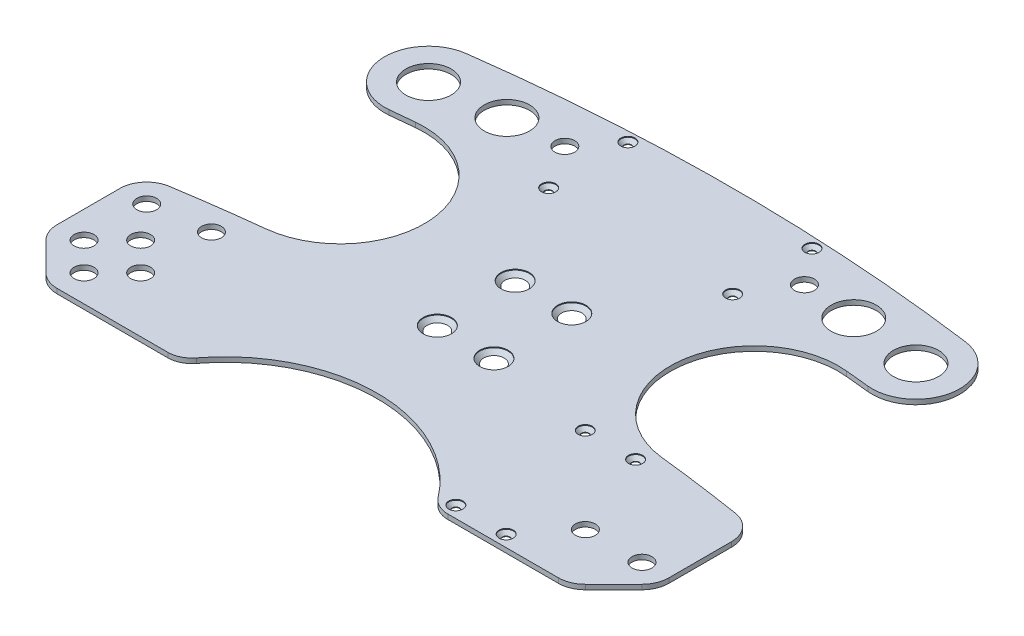
from build123d import *

# Parameters (mm, degrees)
SKETCH1_R                                      = 2.5
BOSS_EXTRUDE1_DEPTH                            = 1.7
CUT_EXTRUDE1_REACH                             = 155.062
SKETCH2_R                                      = 3.5
SKETCH2_R_2                                    = 8
CUT_EXTRUDE2_REACH                             = 155.062
SKETCH3_R                                      = 1.3
CSK_FOR_M5_FLAT_HEAD_MACHINE_SCREW1_AT_2_COUNT = 2
CSK_FOR_M5_FLAT_HEAD_MACHINE_SCREW1_AT_2_PITCH = 20
CSK_FOR_M5_FLAT_HEAD_MACHINE_SCREW1_AT_3_COUNT = 2
CSK_FOR_M5_FLAT_HEAD_MACHINE_SCREW1_AT_3_PITCH = 34.003676272
CSK_FOR_M5_FLAT_HEAD_MACHINE_SCREW1_AT_4_COUNT = 2
CSK_FOR_M5_FLAT_HEAD_MACHINE_SCREW1_AT_4_PITCH = 27.5
CUT_EXTRUDE3_REACH                             = 136.744
SKETCH8_R                                      = 1.3
CSK_FOR_M2_5_FLAT_HEAD_MACHINE_SCREW1_AT_COUNT = 2
CSK_FOR_M2_5_FLAT_HEAD_MACHINE_SCREW1_AT_PITCH = 17.78
CSK_FOR_M2_5_FLAT_HEAD_MACHINE_SCREW_2_COUNT   = 2
CSK_FOR_M2_5_FLAT_HEAD_MACHINE_SCREW_2_PITCH   = 49.055548106
CSK_FOR_M2_5_FLAT_HEAD_MACHINE_SCREW_3_COUNT   = 2
CSK_FOR_M2_5_FLAT_HEAD_MACHINE_SCREW_3_PITCH   = 45.72
CSK_FOR_M2_5_FLAT_HEAD_MACHINE_SCREW_4_COUNT   = 2
CSK_FOR_M2_5_FLAT_HEAD_MACHINE_SCREW_4_PITCH   = 96.995284539
CSK_FOR_M2_5_FLAT_HEAD_MACHINE_SCREW_5_COUNT   = 2
CSK_FOR_M2_5_FLAT_HEAD_MACHINE_SCREW_5_PITCH   = 69.509163048
CSK_FOR_M2_5_FLAT_HEAD_MACHINE_SCREW_6_COUNT   = 2
CSK_FOR_M2_5_FLAT_HEAD_MACHINE_SCREW_6_PITCH   = 125.17053696
CSK_FOR_M2_5_FLAT_HEAD_MACHINE_SCREW_7_COUNT   = 2
CSK_FOR_M2_5_FLAT_HEAD_MACHINE_SCREW_7_PITCH   = 105.3143003
FILLET1_R                                      = 8.5


with BuildPart() as part:
    # Sketch1 → Boss-Extrude1 (new body)
    with BuildSketch(Plane(origin=(0, 0, 0), x_dir=(1, 0, 0), z_dir=(0, 1, 0))):
        with BuildLine():
            Line((-73.314391493, -95), (73.314391493, -95))
            ThreePointArc((73.314391493, -95), (120, 0), (73.314391493, 95))
            Line((73.314391493, 95), (-73.314391493, 95))
            ThreePointArc((-73.314391493, 95), (-120, 0), (-73.314391493, -95))
        make_face()
        with Locations((-10, 13.75)):
            Circle(SKETCH1_R, mode=Mode.SUBTRACT)
        with Locations((-10, -13.75)):
            Circle(SKETCH1_R, mode=Mode.SUBTRACT)
        with Locations((10, -13.75)):
            Circle(SKETCH1_R, mode=Mode.SUBTRACT)
        with Locations((10, 13.75)):
            Circle(SKETCH1_R, mode=Mode.SUBTRACT)
    extrude(amount=BOSS_EXTRUDE1_DEPTH)

    # Sketch2 → Cut-Extrude1 (cut, up to next)
    with BuildSketch(Plane(origin=(0, 1.7, 0), x_dir=(1, 0, 0), z_dir=(0, 1, 0)), mode=Mode.PRIVATE) as cut_extrude1_sk1:
        with Locations((-88.540600769, -40)):
            Circle(SKETCH2_R)
    cut_extrude1_tool1 = extrude(cut_extrude1_sk1.sketch, amount=-CUT_EXTRUDE1_REACH, mode=Mode.PRIVATE) & part.part
    # Sketch2 → Cut-Extrude1 (cut, up to next)
    with BuildSketch(Plane(origin=(0, 1.7, 0), x_dir=(1, 0, 0), z_dir=(0, 1, 0)), mode=Mode.PRIVATE) as cut_extrude1_sk2:
        with Locations((-78.540600769, -50)):
            Circle(SKETCH2_R)
    cut_extrude1_tool2 = extrude(cut_extrude1_sk2.sketch, amount=-CUT_EXTRUDE1_REACH, mode=Mode.PRIVATE) & part.part
    # Sketch2 → Cut-Extrude1 (cut, up to next)
    with BuildSketch(Plane(origin=(0, 1.7, 0), x_dir=(1, 0, 0), z_dir=(0, 1, 0)), mode=Mode.PRIVATE) as cut_extrude1_sk3:
        with Locations((-88.540600769, -60)):
            Circle(SKETCH2_R)
    cut_extrude1_tool3 = extrude(cut_extrude1_sk3.sketch, amount=-CUT_EXTRUDE1_REACH, mode=Mode.PRIVATE) & part.part
    # Sketch2 → Cut-Extrude1 (cut, up to next)
    with BuildSketch(Plane(origin=(0, 1.7, 0), x_dir=(1, 0, 0), z_dir=(0, 1, 0)), mode=Mode.PRIVATE) as cut_extrude1_sk4:
        with Locations((-98.540600769, -50)):
            Circle(SKETCH2_R)
    cut_extrude1_tool4 = extrude(cut_extrude1_sk4.sketch, amount=-CUT_EXTRUDE1_REACH, mode=Mode.PRIVATE) & part.part
    # Sketch2 → Cut-Extrude1 (cut, up to next)
    with BuildSketch(Plane(origin=(0, 1.7, 0), x_dir=(1, 0, 0), z_dir=(0, 1, 0)), mode=Mode.PRIVATE) as cut_extrude1_sk5:
        with Locations((78.540600769, -50)):
            Circle(SKETCH2_R)
    cut_extrude1_tool5 = extrude(cut_extrude1_sk5.sketch, amount=-CUT_EXTRUDE1_REACH, mode=Mode.PRIVATE) & part.part
    # Sketch2 → Cut-Extrude1 (cut, up to next)
    with BuildSketch(Plane(origin=(0, 1.7, 0), x_dir=(1, 0, 0), z_dir=(0, 1, 0)), mode=Mode.PRIVATE) as cut_extrude1_sk6:
        with Locations((98.540600769, -50)):
            Circle(SKETCH2_R)
    cut_extrude1_tool6 = extrude(cut_extrude1_sk6.sketch, amount=-CUT_EXTRUDE1_REACH, mode=Mode.PRIVATE) & part.part
    # Sketch2 → Cut-Extrude1 (cut, up to next)
    with BuildSketch(Plane(origin=(0, 1.7, 0), x_dir=(1, 0, 0), z_dir=(0, 1, 0)), mode=Mode.PRIVATE) as cut_extrude1_sk7:
        with Locations((-98.540600769, -27.862546721)):
            Circle(SKETCH2_R)
    cut_extrude1_tool7 = extrude(cut_extrude1_sk7.sketch, amount=-CUT_EXTRUDE1_REACH, mode=Mode.PRIVATE) & part.part
    # Sketch2 → Cut-Extrude1 (cut, up to next)
    with BuildSketch(Plane(origin=(0, 1.7, 0), x_dir=(1, 0, 0), z_dir=(0, 1, 0)), mode=Mode.PRIVATE) as cut_extrude1_sk8:
        with Locations((-78.540600769, -25)):
            Circle(SKETCH2_R)
    cut_extrude1_tool8 = extrude(cut_extrude1_sk8.sketch, amount=-CUT_EXTRUDE1_REACH, mode=Mode.PRIVATE) & part.part
    # Sketch2 → Cut-Extrude1 (cut, up to next)
    with BuildSketch(Plane(origin=(0, 1.7, 0), x_dir=(1, 0, 0), z_dir=(0, 1, 0)), mode=Mode.PRIVATE) as cut_extrude1_sk9:
        with Locations((-86.094520408, 59.228232759)):
            Circle(SKETCH2_R_2)
    cut_extrude1_tool9 = extrude(cut_extrude1_sk9.sketch, amount=-CUT_EXTRUDE1_REACH, mode=Mode.PRIVATE) & part.part
    # Sketch2 → Cut-Extrude1 (cut, up to next)
    with BuildSketch(Plane(origin=(0, 1.7, 0), x_dir=(1, 0, 0), z_dir=(0, 1, 0)), mode=Mode.PRIVATE) as cut_extrude1_sk10:
        with Locations((-61.259580586, 62.084312054)):
            Circle(SKETCH2_R_2)
    cut_extrude1_tool10 = extrude(cut_extrude1_sk10.sketch, amount=-CUT_EXTRUDE1_REACH, mode=Mode.PRIVATE) & part.part
    # Sketch2 → Cut-Extrude1 (cut, up to next)
    with BuildSketch(Plane(origin=(0, 1.7, 0), x_dir=(1, 0, 0), z_dir=(0, 1, 0)), mode=Mode.PRIVATE) as cut_extrude1_sk11:
        with Locations((61.259580586, 62.084312054)):
            Circle(SKETCH2_R_2)
    cut_extrude1_tool11 = extrude(cut_extrude1_sk11.sketch, amount=-CUT_EXTRUDE1_REACH, mode=Mode.PRIVATE) & part.part
    # Sketch2 → Cut-Extrude1 (cut, up to next)
    with BuildSketch(Plane(origin=(0, 1.7, 0), x_dir=(1, 0, 0), z_dir=(0, 1, 0)), mode=Mode.PRIVATE) as cut_extrude1_sk12:
        with Locations((86.094520408, 59.228232759)):
            Circle(SKETCH2_R_2)
    cut_extrude1_tool12 = extrude(cut_extrude1_sk12.sketch, amount=-CUT_EXTRUDE1_REACH, mode=Mode.PRIVATE) & part.part
    # Sketch2 → Cut-Extrude1 (cut, up to next)
    with BuildSketch(Plane(origin=(0, 1.7, 0), x_dir=(1, 0, 0), z_dir=(0, 1, 0)), mode=Mode.PRIVATE) as cut_extrude1_sk13:
        with Locations((-42.320942156, 63.610082158)):
            Circle(SKETCH2_R)
    cut_extrude1_tool13 = extrude(cut_extrude1_sk13.sketch, amount=-CUT_EXTRUDE1_REACH, mode=Mode.PRIVATE) & part.part
    # Sketch2 → Cut-Extrude1 (cut, up to next)
    with BuildSketch(Plane(origin=(0, 1.7, 0), x_dir=(1, 0, 0), z_dir=(0, 1, 0)), mode=Mode.PRIVATE) as cut_extrude1_sk14:
        with Locations((42.320942156, 63.610082158)):
            Circle(SKETCH2_R)
    cut_extrude1_tool14 = extrude(cut_extrude1_sk14.sketch, amount=-CUT_EXTRUDE1_REACH, mode=Mode.PRIVATE) & part.part
    add(cut_extrude1_tool1.solids().sort_by_distance((-88.540601, 1.7, 40))[0], mode=Mode.SUBTRACT)
    add(cut_extrude1_tool2.solids().sort_by_distance((-78.540601, 1.7, 50))[0], mode=Mode.SUBTRACT)
    add(cut_extrude1_tool3.solids().sort_by_distance((-88.540601, 1.7, 60))[0], mode=Mode.SUBTRACT)
    add(cut_extrude1_tool4.solids().sort_by_distance((-98.540601, 1.7, 50))[0], mode=Mode.SUBTRACT)
    add(cut_extrude1_tool5.solids().sort_by_distance((78.540601, 1.7, 50))[0], mode=Mode.SUBTRACT)
    add(cut_extrude1_tool6.solids().sort_by_distance((98.540601, 1.7, 50))[0], mode=Mode.SUBTRACT)
    add(cut_extrude1_tool7.solids().sort_by_distance((-98.540601, 1.7, 27.862547))[0], mode=Mode.SUBTRACT)
    add(cut_extrude1_tool8.solids().sort_by_distance((-78.540601, 1.7, 25))[0], mode=Mode.SUBTRACT)
    add(cut_extrude1_tool9.solids().sort_by_distance((-86.09452, 1.7, -59.228233))[0], mode=Mode.SUBTRACT)
    add(cut_extrude1_tool10.solids().sort_by_distance((-61.259581, 1.7, -62.084312))[0], mode=Mode.SUBTRACT)
    add(cut_extrude1_tool11.solids().sort_by_distance((61.259581, 1.7, -62.084312))[0], mode=Mode.SUBTRACT)
    add(cut_extrude1_tool12.solids().sort_by_distance((86.09452, 1.7, -59.228233))[0], mode=Mode.SUBTRACT)
    add(cut_extrude1_tool13.solids().sort_by_distance((-42.320942, 1.7, -63.610082))[0], mode=Mode.SUBTRACT)
    add(cut_extrude1_tool14.solids().sort_by_distance((42.320942, 1.7, -63.610082))[0], mode=Mode.SUBTRACT)

    # Sketch3 → Cut-Extrude2 (cut, up to next)
    with BuildSketch(Plane(origin=(0, 1.7, 0), x_dir=(1, 0, 0), z_dir=(0, 1, 0)), mode=Mode.PRIVATE) as cut_extrude2_sk1:
        with BuildLine():
            Line((-76.105925997, 44.650651574), (-84.550645906, 43.805313077))
            ThreePointArc((-84.550645906, 43.805313077), (-99.436668511, 51.3391844), (-98.864520746, 68.013282068))
            ThreePointArc((-98.864520746, 68.013282068), (-119.734623685, 7.97620781), (-107.012417284, -54.298642221))
            ThreePointArc((-107.012417284, -54.298642221), (-107.779979993, -52.209948315), (-108.040600769, -50))
            Line((-108.040600769, -50), (-108.040600769, -27.862546721))
            ThreePointArc((-108.040600769, -27.862546721), (-105.768300058, -21.697292226), (-100.038419088, -18.48136661))
            ThreePointArc((-100.038419088, -18.48136661), (-84.982869082, -16.262381048), (-69.878431955, -14.405108328))
            ThreePointArc((-69.878431955, -14.405108328), (-43.620166463, 18.220082253), (-76.105925997, 44.650651574))
        make_face()
    cut_extrude2_tool1 = extrude(cut_extrude2_sk1.sketch, amount=-CUT_EXTRUDE2_REACH, mode=Mode.PRIVATE) & part.part
    # Sketch3 → Cut-Extrude2 (cut, up to next)
    with BuildSketch(Plane(origin=(0, 1.7, 0), x_dir=(1, 0, 0), z_dir=(0, 1, 0)), mode=Mode.PRIVATE) as cut_extrude2_sk2:
        with BuildLine():
            ThreePointArc((-98.864520746, 68.013282068), (-94.209950954, 72.433905292), (-88.163447862, 74.589532807))
            ThreePointArc((-88.163447862, 74.589532807), (1.3e-08, 80.5), (88.163447888, 74.589532804))
            ThreePointArc((88.163447888, 74.589532804), (94.209951277, 72.433905093), (98.864521161, 68.013281465))
            ThreePointArc((98.864521161, 68.013281465), (87.140491363, 82.50172583), (73.314391493, 95))
            Line((73.314391493, 95), (-73.314391493, 95))
            ThreePointArc((-73.314391493, 95), (-87.140491112, 82.501726096), (-98.864520746, 68.013282068))
        make_face()
    cut_extrude2_tool2 = extrude(cut_extrude2_sk2.sketch, amount=-CUT_EXTRUDE2_REACH, mode=Mode.PRIVATE) & part.part
    # Sketch3 → Cut-Extrude2 (cut, up to next)
    with BuildSketch(Plane(origin=(0, 1.7, 0), x_dir=(1, 0, 0), z_dir=(0, 1, 0)), mode=Mode.PRIVATE) as cut_extrude2_sk3:
        with BuildLine():
            ThreePointArc((-105.258115191, -56.717514421), (-106.230963521, -55.577483371), (-107.012417284, -54.298642221))
            ThreePointArc((-107.012417284, -54.298642221), (-92.431540192, -76.527187181), (-73.314391493, -95))
            Line((-73.314391493, -95), (73.314391493, -95))
            ThreePointArc((73.314391493, -95), (92.431540082, -76.527187314), (107.012417128, -54.298642528))
            ThreePointArc((107.012417128, -54.298642528), (106.23096342, -55.57748351), (105.258115191, -56.717514421))
            Line((105.258115191, -56.717514421), (95.258115191, -66.717514421))
            ThreePointArc((95.258115191, -66.717514421), (92.176093377, -68.776855559), (88.540600769, -69.5))
            Line((88.540600769, -69.5), (45.040600769, -69.5))
            ThreePointArc((45.040600769, -69.5), (0, -45), (-45.040600769, -69.5))
            Line((-45.040600769, -69.5), (-88.540600769, -69.5))
            ThreePointArc((-88.540600769, -69.5), (-92.176093377, -68.776855559), (-95.258115191, -66.717514421))
            Line((-95.258115191, -66.717514421), (-105.258115191, -56.717514421))
        make_face()
    cut_extrude2_tool3 = extrude(cut_extrude2_sk3.sketch, amount=-CUT_EXTRUDE2_REACH, mode=Mode.PRIVATE) & part.part
    # Sketch3 → Cut-Extrude2 (cut, up to next)
    with BuildSketch(Plane(origin=(0, 1.7, 0), x_dir=(1, 0, 0), z_dir=(0, 1, 0)), mode=Mode.PRIVATE) as cut_extrude2_sk4:
        with BuildLine():
            ThreePointArc((69.878431166, -14.405108241), (84.982868127, -16.262380919), (100.038417968, -18.481366431))
            ThreePointArc((100.038417968, -18.481366431), (105.768299691, -21.697291795), (108.040600769, -27.862546721))
            Line((108.040600769, -27.862546721), (108.040600769, -50))
            ThreePointArc((108.040600769, -50), (107.779979953, -52.209948483), (107.012417128, -54.298642528))
            ThreePointArc((107.012417128, -54.298642528), (119.734623721, 7.976207273), (98.864521161, 68.013281465))
            ThreePointArc((98.864521161, 68.013281465), (99.436668324, 51.339184085), (84.550645906, 43.805313077))
            Line((84.550645906, 43.805313077), (76.105925997, 44.650651574))
            ThreePointArc((76.105925997, 44.650651574), (43.620166505, 18.220082647), (69.878431166, -14.405108241))
        make_face()
    cut_extrude2_tool4 = extrude(cut_extrude2_sk4.sketch, amount=-CUT_EXTRUDE2_REACH, mode=Mode.PRIVATE) & part.part
    # Sketch3 → Cut-Extrude2 (cut, up to next)
    with BuildSketch(Plane(origin=(0, 1.7, 0), x_dir=(1, 0, 0), z_dir=(0, 1, 0)), mode=Mode.PRIVATE) as cut_extrude2_sk5:
        with Locations((48.150600769, -19.64)):
            Circle(SKETCH3_R)
    cut_extrude2_tool5 = extrude(cut_extrude2_sk5.sketch, amount=-CUT_EXTRUDE2_REACH, mode=Mode.PRIVATE) & part.part
    # Sketch3 → Cut-Extrude2 (cut, up to next)
    with BuildSketch(Plane(origin=(0, 1.7, 0), x_dir=(1, 0, 0), z_dir=(0, 1, 0)), mode=Mode.PRIVATE) as cut_extrude2_sk6:
        with Locations((65.930600769, -19.64)):
            Circle(SKETCH3_R)
    cut_extrude2_tool6 = extrude(cut_extrude2_sk6.sketch, amount=-CUT_EXTRUDE2_REACH, mode=Mode.PRIVATE) & part.part
    # Sketch3 → Cut-Extrude2 (cut, up to next)
    with BuildSketch(Plane(origin=(0, 1.7, 0), x_dir=(1, 0, 0), z_dir=(0, 1, 0)), mode=Mode.PRIVATE) as cut_extrude2_sk7:
        with Locations((65.930600769, -65.36)):
            Circle(SKETCH3_R)
    cut_extrude2_tool7 = extrude(cut_extrude2_sk7.sketch, amount=-CUT_EXTRUDE2_REACH, mode=Mode.PRIVATE) & part.part
    # Sketch3 → Cut-Extrude2 (cut, up to next)
    with BuildSketch(Plane(origin=(0, 1.7, 0), x_dir=(1, 0, 0), z_dir=(0, 1, 0)), mode=Mode.PRIVATE) as cut_extrude2_sk8:
        with Locations((48.150600769, -65.36)):
            Circle(SKETCH3_R)
    cut_extrude2_tool8 = extrude(cut_extrude2_sk8.sketch, amount=-CUT_EXTRUDE2_REACH, mode=Mode.PRIVATE) & part.part
    add(cut_extrude2_tool1.solids().sort_by_distance((-86.043963, 1.7, -12.513289))[0], mode=Mode.SUBTRACT)
    add(cut_extrude2_tool2.solids().sort_by_distance((0, 1.7, -86.177495))[0], mode=Mode.SUBTRACT)
    add(cut_extrude2_tool3.solids().sort_by_distance((0, 1.7, 75.736765))[0], mode=Mode.SUBTRACT)
    add(cut_extrude2_tool4.solids().sort_by_distance((86.043963, 1.7, -12.513289))[0], mode=Mode.SUBTRACT)
    add(cut_extrude2_tool5.solids().sort_by_distance((48.150601, 1.7, 19.64))[0], mode=Mode.SUBTRACT)
    add(cut_extrude2_tool6.solids().sort_by_distance((65.930601, 1.7, 19.64))[0], mode=Mode.SUBTRACT)
    add(cut_extrude2_tool7.solids().sort_by_distance((65.930601, 1.7, 65.36))[0], mode=Mode.SUBTRACT)
    add(cut_extrude2_tool8.solids().sort_by_distance((48.150601, 1.7, 65.36))[0], mode=Mode.SUBTRACT)

    # Sketch5 → CSK for M5 Flat Head Machine Screw1 (revolve, cut)
    with BuildSketch(Plane(origin=(-10, 1.7, -13.75), x_dir=(0, 0, 1), z_dir=(1, 0, 0))):
        Polygon((0, 0), (0, 6.502151548), (2.5, 5), (2.5, 2.8), (5, 0.3), (5, 0), align=None)
    csk_for_m5_flat_head_machine_screw1 = revolve(axis=Axis((-10, 8.05, -13.75), (0, -1, 0)), mode=Mode.SUBTRACT)

    # CSK for M5 Flat Head Machine Screw1 at 2: CSK for M5 Flat Head Machine Screw1 ×2
    with Locations(*[(i * CSK_FOR_M5_FLAT_HEAD_MACHINE_SCREW1_AT_2_PITCH, 0, 0) for i in range(1, CSK_FOR_M5_FLAT_HEAD_MACHINE_SCREW1_AT_2_COUNT)]):
        add(csk_for_m5_flat_head_machine_screw1, mode=Mode.SUBTRACT)

    # CSK for M5 Flat Head Machine Screw1 at 3: CSK for M5 Flat Head Machine Screw1 ×2
    with Locations(*[Vector(0.5881716976750462, 0, 0.8087360843031886) * (i * CSK_FOR_M5_FLAT_HEAD_MACHINE_SCREW1_AT_3_PITCH) for i in range(1, CSK_FOR_M5_FLAT_HEAD_MACHINE_SCREW1_AT_3_COUNT)]):
        add(csk_for_m5_flat_head_machine_screw1, mode=Mode.SUBTRACT)

    # CSK for M5 Flat Head Machine Screw1 at 4: CSK for M5 Flat Head Machine Screw1 ×2
    with Locations(*[(0, 0, i * CSK_FOR_M5_FLAT_HEAD_MACHINE_SCREW1_AT_4_PITCH) for i in range(1, CSK_FOR_M5_FLAT_HEAD_MACHINE_SCREW1_AT_4_COUNT)]):
        add(csk_for_m5_flat_head_machine_screw1, mode=Mode.SUBTRACT)

    # Sketch8 → Cut-Extrude3 (cut, up to next)
    with BuildSketch(Plane.XZ, mode=Mode.PRIVATE) as cut_extrude3_sk1:
        with Locations((-32.5, -48.084312054)):
            Circle(SKETCH8_R)
    cut_extrude3_tool1 = extrude(cut_extrude3_sk1.sketch, amount=-CUT_EXTRUDE3_REACH, mode=Mode.PRIVATE) & part.part
    # Sketch8 → Cut-Extrude3 (cut, up to next)
    with BuildSketch(Plane.XZ, mode=Mode.PRIVATE) as cut_extrude3_sk2:
        with Locations((32.5, -48.084312054)):
            Circle(SKETCH8_R)
    cut_extrude3_tool2 = extrude(cut_extrude3_sk2.sketch, amount=-CUT_EXTRUDE3_REACH, mode=Mode.PRIVATE) & part.part
    # Sketch8 → Cut-Extrude3 (cut, up to next)
    with BuildSketch(Plane.XZ, mode=Mode.PRIVATE) as cut_extrude3_sk3:
        with Locations((32.5, -76.084312054)):
            Circle(SKETCH8_R)
    cut_extrude3_tool3 = extrude(cut_extrude3_sk3.sketch, amount=-CUT_EXTRUDE3_REACH, mode=Mode.PRIVATE) & part.part
    # Sketch8 → Cut-Extrude3 (cut, up to next)
    with BuildSketch(Plane.XZ, mode=Mode.PRIVATE) as cut_extrude3_sk4:
        with Locations((-32.5, -76.084312054)):
            Circle(SKETCH8_R)
    cut_extrude3_tool4 = extrude(cut_extrude3_sk4.sketch, amount=-CUT_EXTRUDE3_REACH, mode=Mode.PRIVATE) & part.part
    add(cut_extrude3_tool1.solids().sort_by_distance((-32.5, 0, -48.084312))[0], mode=Mode.SUBTRACT)
    add(cut_extrude3_tool2.solids().sort_by_distance((32.5, 0, -48.084312))[0], mode=Mode.SUBTRACT)
    add(cut_extrude3_tool3.solids().sort_by_distance((32.5, 0, -76.084312))[0], mode=Mode.SUBTRACT)
    add(cut_extrude3_tool4.solids().sort_by_distance((-32.5, 0, -76.084312))[0], mode=Mode.SUBTRACT)

    # Sketch7 → CSK for M2.5 Flat Head Machine Screw1 (revolve, cut)
    with BuildSketch(Plane(origin=(48.150600769, 1.7, 19.64), x_dir=(0, 0, 1), z_dir=(1, 0, 0))):
        Polygon((0, 0), (0, 5.751075774), (1.25, 5), (1.25, 1.55), (2.5, 0.3), (2.5, 0), align=None)
    csk_for_m2_5_flat_head_machine_screw1 = revolve(axis=Axis((48.150600769, 8.05, 19.64), (0, -1, 0)), mode=Mode.SUBTRACT)

    # CSK for M2.5 Flat Head Machine Screw1 at: CSK for M2.5 Flat Head Machine Screw1 ×2
    with Locations(*[(i * CSK_FOR_M2_5_FLAT_HEAD_MACHINE_SCREW1_AT_PITCH, 0, 0) for i in range(1, CSK_FOR_M2_5_FLAT_HEAD_MACHINE_SCREW1_AT_COUNT)]):
        add(csk_for_m2_5_flat_head_machine_screw1, mode=Mode.SUBTRACT)

    # CSK for M2.5 Flat Head Machine Screw 2: CSK for M2.5 Flat Head Machine Screw1 ×2
    with Locations(*[Vector(0.3624462611549487, 0, 0.9320046715412958) * (i * CSK_FOR_M2_5_FLAT_HEAD_MACHINE_SCREW_2_PITCH) for i in range(1, CSK_FOR_M2_5_FLAT_HEAD_MACHINE_SCREW_2_COUNT)]):
        add(csk_for_m2_5_flat_head_machine_screw1, mode=Mode.SUBTRACT)

    # CSK for M2.5 Flat Head Machine Screw 3: CSK for M2.5 Flat Head Machine Screw1 ×2
    with Locations(*[(0, 0, i * CSK_FOR_M2_5_FLAT_HEAD_MACHINE_SCREW_3_PITCH) for i in range(1, CSK_FOR_M2_5_FLAT_HEAD_MACHINE_SCREW_3_COUNT)]):
        add(csk_for_m2_5_flat_head_machine_screw1, mode=Mode.SUBTRACT)

    # CSK for M2.5 Flat Head Machine Screw 4: CSK for M2.5 Flat Head Machine Screw1 ×2
    with Locations(*[Vector(-0.1613542435992395, 0, -0.9868965538862304) * (i * CSK_FOR_M2_5_FLAT_HEAD_MACHINE_SCREW_4_PITCH) for i in range(1, CSK_FOR_M2_5_FLAT_HEAD_MACHINE_SCREW_4_COUNT)]):
        add(csk_for_m2_5_flat_head_machine_screw1, mode=Mode.SUBTRACT)

    # CSK for M2.5 Flat Head Machine Screw 5: CSK for M2.5 Flat Head Machine Screw1 ×2
    with Locations(*[Vector(-0.2251588147958565, 0, -0.9743220761738519) * (i * CSK_FOR_M2_5_FLAT_HEAD_MACHINE_SCREW_5_PITCH) for i in range(1, CSK_FOR_M2_5_FLAT_HEAD_MACHINE_SCREW_5_COUNT)]):
        add(csk_for_m2_5_flat_head_machine_screw1, mode=Mode.SUBTRACT)

    # CSK for M2.5 Flat Head Machine Screw 6: CSK for M2.5 Flat Head Machine Screw1 ×2
    with Locations(*[Vector(-0.6443257553128567, 0, -0.7647511497477573) * (i * CSK_FOR_M2_5_FLAT_HEAD_MACHINE_SCREW_6_PITCH) for i in range(1, CSK_FOR_M2_5_FLAT_HEAD_MACHINE_SCREW_6_COUNT)]):
        add(csk_for_m2_5_flat_head_machine_screw1, mode=Mode.SUBTRACT)

    # CSK for M2.5 Flat Head Machine Screw 7: CSK for M2.5 Flat Head Machine Screw1 ×2
    with Locations(*[Vector(-0.7658086369994986, 0, -0.6430685278389622) * (i * CSK_FOR_M2_5_FLAT_HEAD_MACHINE_SCREW_7_PITCH) for i in range(1, CSK_FOR_M2_5_FLAT_HEAD_MACHINE_SCREW_7_COUNT)]):
        add(csk_for_m2_5_flat_head_machine_screw1, mode=Mode.SUBTRACT)

    # Fillet1
    fillet1_edges = [part.edges().sort_by_distance(p)[0] for p in [
        (45.040600769, 0.85, 69.5),
        (-45.040600769, 0.85, 69.5),
    ]]
    fillet(fillet1_edges, radius=FILLET1_R)


solid = part.part
